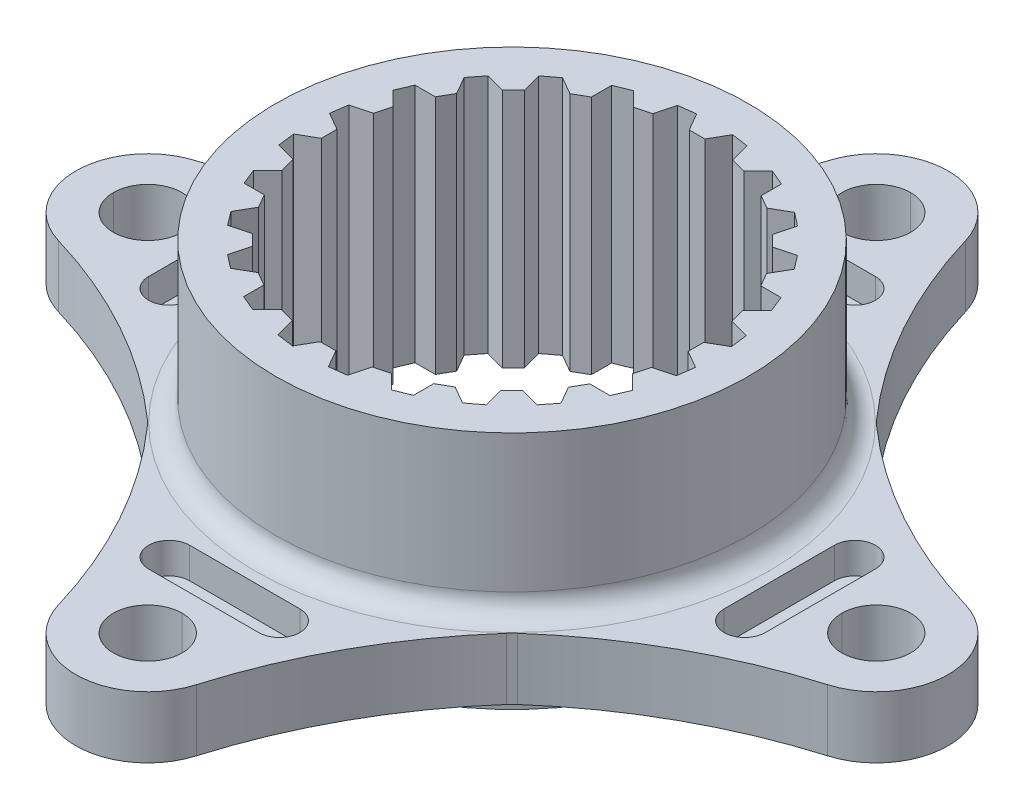
from build123d import *

# Parameters (mm, degrees)
SKETCH8_R                = 100
BOSS_EXTRUDE4_DEPTH      = 27.178
CUT_EXTRUDE1_DEPTH       = 145.009179166
SKETCH9_OUTSIDE_W        = 258.83
SKETCH9_OUTSIDE_H        = 258.83
SKETCH9_OUTSIDE_R        = 29.21
CUT_EXTRUDE3_DEPTH       = 19.558
CUT_EXTRUDE6_START       = -7.62
SKETCH11_R               = 100
CUT_EXTRUDE6_DEPTH       = 7.62
SKETCH10_R               = 4.2545
CUT_EXTRUDE7_DEPTH       = 7.62
FILLET2_R                = 2.54
FILLET3_R                = 7.62
CUT_EXTRUDE12_DEPTH      = 3.81
FILLET5_R                = 2.54
CIRPATTERN1_COUNT        = 4
FILLET5_OF_CIRPATTERN1_R = 2.54
SKETCH14_R               = 29.0322
BOSS_EXTRUDE5_DEPTH      = 2.54
CUT_EXTRUDE17_DEPTH      = 2.54


with BuildPart() as part:
    # Sketch8 → Boss-Extrude4 (new body)
    with BuildSketch(Plane(origin=(0, 0, 0), x_dir=(1, 0, 0), z_dir=(0, 1, 0))):
        with Locations(Location((0, 0, 0), (0, 0, 270))):
            Circle(SKETCH8_R)
    extrude(amount=BOSS_EXTRUDE4_DEPTH)

    # Sketch6 → Cut-Extrude1 (cut, through all)
    with BuildSketch(Plane(origin=(0, 0, 0), x_dir=(1, 0, 0), z_dir=(0, 1, 0))):
        Polygon((-0.9689411, -22.736267788), (0.9689411, -22.736267788), (2.2189411, -24.901331298), (4.303288018, -24.645405677), (4.950335631, -22.230591111), (6.822186096, -21.72903029), (8.589953049, -23.496797243), (10.537039143, -22.710123397), (10.537039143, -20.210123397), (12.215294358, -19.241182297), (14.380357867, -20.491182297), (16.057492438, -19.227370749), (15.410444825, -16.812556183), (16.78073447, -15.442266539), (19.195549035, -16.089314151), (20.488438134, -14.434491569), (19.238438134, -12.269428059), (20.207379233, -10.591172845), (22.707379233, -10.591172845), (23.527914603, -8.658112653), (21.76014765, -6.8903457), (22.261708471, -5.018495235), (24.676523036, -4.371447622), (24.968786548, -2.291884678), (22.803723039, -1.041884678), (22.803723039, 0.895997521), (24.968786548, 2.145997521), (24.712860927, 4.23034444), (22.298046362, 4.877392053), (21.796485541, 6.749242517), (23.564252494, 8.51700947), (22.777578648, 10.464095565), (20.277578648, 10.464095565), (19.308637548, 12.142350779), (20.558637548, 14.307414289), (19.294826, 15.98454886), (16.880011434, 15.337501247), (15.509721789, 16.707790891), (16.156769402, 19.122605457), (14.50194682, 20.415494555), (12.33688331, 19.165494555), (10.658628096, 20.134435655), (10.658628096, 22.634435655), (8.725567904, 23.454971025), (6.957800951, 21.687204072), (5.085950486, 22.188764892), (4.438902873, 24.603579458), (2.359339929, 24.89584297), (1.109339929, 22.730779461), (-0.828542271, 22.730779461), (-2.078542271, 24.89584297), (-4.162889189, 24.639917349), (-4.809936802, 22.225102783), (-6.681787267, 21.723541963), (-8.44955422, 23.491308916), (-10.396640314, 22.70463507), (-10.396640314, 20.20463507), (-12.074895529, 19.23569397), (-14.239959038, 20.48569397), (-15.917093609, 19.221882421), (-15.270045996, 16.807067856), (-16.640335641, 15.436778211), (-19.055150206, 16.083825824), (-20.348039305, 14.429003241), (-19.098039305, 12.263939732), (-20.066980404, 10.585684518), (-22.566980404, 10.585684518), (-23.387515774, 8.652624325), (-21.619748821, 6.884857372), (-22.121309642, 5.013006908), (-24.536124207, 4.365959295), (-24.828387719, 2.28639635), (-22.66332421, 1.03639635), (-22.66332421, -0.901485849), (-24.828387719, -2.151485849), (-24.572462098, -4.235832767), (-22.157647532, -4.88288038), (-21.656086712, -6.754730845), (-23.423853665, -8.522497798), (-22.637179819, -10.469583893), (-20.137179819, -10.469583893), (-19.168238719, -12.147839107), (-20.418238719, -14.312902616), (-19.154427171, -15.990037187), (-16.739612605, -15.342989575), (-15.36932296, -16.713279219), (-16.016370573, -19.128093785), (-14.361547991, -20.420982883), (-12.196484481, -19.170982883), (-10.518229267, -20.139923983), (-10.518229267, -22.639923983), (-8.585169075, -23.460459352), (-6.817402122, -21.6926924), (-4.945551657, -22.19425322), (-4.298504044, -24.609067786), (-2.2189411, -24.901331298), align=None)
    extrude(amount=CUT_EXTRUDE1_DEPTH, mode=Mode.SUBTRACT)

    # Sketch9 outside → Cut-Extrude3 (cut)
    with BuildSketch(Plane(origin=(0, 27.178, 0), x_dir=(1, 0, 0), z_dir=(0, 1, 0))):
        Rectangle(SKETCH9_OUTSIDE_W, SKETCH9_OUTSIDE_H)
        with Locations(Location((0, 0, 0), (0, 0, 270))):
            Circle(SKETCH9_OUTSIDE_R, mode=Mode.SUBTRACT)
    extrude(amount=-CUT_EXTRUDE3_DEPTH, mode=Mode.SUBTRACT)

    # Sketch11 → Cut-Extrude6 (cut)
    with BuildSketch(Plane(origin=(0, 7.62, 0), x_dir=(1, 0, 0), z_dir=(0, 1, 0)).offset(CUT_EXTRUDE6_START)):
        Circle(SKETCH11_R)
        with BuildLine():
            ThreePointArc((-8.523907443, 47.533696414), (0, 53.8988), (8.523907443, 47.533696414))
            ThreePointArc((8.523907443, 47.533696414), (14.122993805, 34.241994768), (22.5044, 22.5044))
            ThreePointArc((22.5044, 22.5044), (34.241994768, 14.122993805), (47.533696414, 8.523907443))
            ThreePointArc((47.533696414, 8.523907443), (52.131946395, 5.319105699), (53.8988, 0))
            ThreePointArc((53.8988, 0), (52.131946395, -5.319105699), (47.533696414, -8.523907443))
            ThreePointArc((47.533696414, -8.523907443), (34.241994768, -14.122993805), (22.5044, -22.5044))
            ThreePointArc((22.5044, -22.5044), (14.122993805, -34.241994768), (8.523907443, -47.533696414))
            ThreePointArc((8.523907443, -47.533696414), (0, -53.8988), (-8.523907443, -47.533696414))
            ThreePointArc((-8.523907443, -47.533696414), (-14.122993805, -34.241994768), (-22.5044, -22.5044))
            ThreePointArc((-22.5044, -22.5044), (-34.241994768, -14.122993805), (-47.533696414, -8.523907443))
            ThreePointArc((-47.533696414, -8.523907443), (-53.8988, 0), (-47.533696414, 8.523907443))
            ThreePointArc((-47.533696414, 8.523907443), (-34.241994768, 14.122993805), (-22.5044, 22.5044))
            ThreePointArc((-22.5044, 22.5044), (-14.122993805, 34.241994768), (-8.523907443, 47.533696414))
        make_face(mode=Mode.SUBTRACT)
    extrude(amount=CUT_EXTRUDE6_DEPTH, mode=Mode.SUBTRACT)

    # Sketch10 → Cut-Extrude7 (cut)
    with BuildSketch(Plane(origin=(0, 7.62, 0), x_dir=(1, 0, 0), z_dir=(0, 1, 0))):
        with Locations(Location((0, 45.0088, 0), (0, 0, 270))):
            Circle(SKETCH10_R)
        with Locations(Location((45.0088, 0, 0), (0, 0, 270))):
            Circle(SKETCH10_R)
        with Locations(Location((0, -45.0088, 0), (0, 0, 270))):
            Circle(SKETCH10_R)
        with Locations(Location((-45.0088, 0, 0), (0, 0, 270))):
            Circle(SKETCH10_R)
    extrude(amount=-CUT_EXTRUDE7_DEPTH, mode=Mode.SUBTRACT)

    # Fillet2
    fillet2_edges = [part.edges().sort_by_distance(p)[0] for p in [
        (0, 7.62, -29.21),
    ]]
    fillet(fillet2_edges, radius=FILLET2_R)

    # Fillet3
    fillet3_edges = [part.edges().sort_by_distance(p)[0] for p in [
        (-22.5044, 3.81, -22.5044),
        (-22.5044, 3.81, 22.5044),
        (22.5044, 3.81, 22.5044),
        (22.5044, 3.81, -22.5044),
    ]]
    fillet(fillet3_edges, radius=FILLET3_R)

    # Sketch13 → Cut-Extrude12 (cut)
    with BuildSketch(Plane(origin=(0, 7.62, 0), x_dir=(1, 0, 0), z_dir=(0, 1, 0))):
        Polygon((-8.426157097, 38.1), (8.426157097, 38.1), (10.795, 33.02), (-10.795, 33.02), align=None)
    cut_extrude12 = extrude(amount=-CUT_EXTRUDE12_DEPTH, mode=Mode.SUBTRACT)

    # Fillet5
    fillet5_edges = [part.edges().sort_by_distance(p)[0] for p in [
        (-10.795, 5.715, -33.02),
        (10.795, 5.715, -33.02),
        (-8.426157097, 5.715, -38.1),
        (8.426157097, 5.715, -38.1),
    ]]
    fillet(fillet5_edges, radius=FILLET5_R - 0.0001)  # a hair under: the kernel refuses the full size

    # CirPattern1: Cut-Extrude12 ×4 about axis
    cirpattern1_axis = Axis((0, 0, 0), (0, 1, 0))
    for i in range(1, CIRPATTERN1_COUNT):
        add(cut_extrude12.rotate(cirpattern1_axis, i * 360 / CIRPATTERN1_COUNT), mode=Mode.SUBTRACT)

    # Fillet5 of CirPattern1
    fillet5_of_cirpattern1_edges = [part.edges().sort_by_distance(p)[0] for p in [
        (-33.02, 5.715, 10.795),
        (-33.02, 5.715, -10.795),
        (-38.1, 5.715, 8.426157097),
        (-38.1, 5.715, -8.426157097),
        (10.795, 5.715, 33.02),
        (-10.795, 5.715, 33.02),
        (8.426157097, 5.715, 38.1),
        (-8.426157097, 5.715, 38.1),
        (33.02, 5.715, -10.795),
        (33.02, 5.715, 10.795),
        (38.1, 5.715, -8.426157097),
        (38.1, 5.715, 8.426157097),
    ]]
    fillet(fillet5_of_cirpattern1_edges, radius=FILLET5_OF_CIRPATTERN1_R - 0.0001)  # a hair under: the kernel refuses the full size

    # Sketch14 → Boss-Extrude5 (add)
    with BuildSketch(Plane.XZ):
        with Locations(Location((0, 0, 0), (0, 0, 90))):
            Circle(SKETCH14_R)
    extrude(amount=BOSS_EXTRUDE5_DEPTH)

    # Sketch6<5> → Cut-Extrude17 (cut)
    with BuildSketch(Plane(origin=(0, 0, 0), x_dir=(1, 0, 0), z_dir=(0, 1, 0))):
        Polygon((-0.9689411, -22.736267788), (0.9689411, -22.736267788), (2.2189411, -24.901331298), (4.303288018, -24.645405677), (4.950335631, -22.230591111), (6.822186096, -21.72903029), (8.589953049, -23.496797243), (10.537039143, -22.710123397), (10.537039143, -20.210123397), (12.215294358, -19.241182297), (14.380357867, -20.491182297), (16.057492438, -19.227370749), (15.410444825, -16.812556183), (16.78073447, -15.442266539), (19.195549035, -16.089314151), (20.488438134, -14.434491569), (19.238438134, -12.269428059), (20.207379233, -10.591172845), (22.707379233, -10.591172845), (23.527914603, -8.658112653), (21.76014765, -6.8903457), (22.261708471, -5.018495235), (24.676523036, -4.371447622), (24.968786548, -2.291884678), (22.803723039, -1.041884678), (22.803723039, 0.895997521), (24.968786548, 2.145997521), (24.712860927, 4.23034444), (22.298046362, 4.877392053), (21.796485541, 6.749242517), (23.564252494, 8.51700947), (22.777578648, 10.464095565), (20.277578648, 10.464095565), (19.308637548, 12.142350779), (20.558637548, 14.307414289), (19.294826, 15.98454886), (16.880011434, 15.337501247), (15.509721789, 16.707790891), (16.156769402, 19.122605457), (14.50194682, 20.415494555), (12.33688331, 19.165494555), (10.658628096, 20.134435655), (10.658628096, 22.634435655), (8.725567904, 23.454971025), (6.957800951, 21.687204072), (5.085950486, 22.188764892), (4.438902873, 24.603579458), (2.359339929, 24.89584297), (1.109339929, 22.730779461), (-0.828542271, 22.730779461), (-2.078542271, 24.89584297), (-4.162889189, 24.639917349), (-4.809936802, 22.225102783), (-6.681787267, 21.723541963), (-8.44955422, 23.491308916), (-10.396640314, 22.70463507), (-10.396640314, 20.20463507), (-12.074895529, 19.23569397), (-14.239959038, 20.48569397), (-15.917093609, 19.221882421), (-15.270045996, 16.807067856), (-16.640335641, 15.436778211), (-19.055150206, 16.083825824), (-20.348039305, 14.429003241), (-19.098039305, 12.263939732), (-20.066980404, 10.585684518), (-22.566980404, 10.585684518), (-23.387515774, 8.652624325), (-21.619748821, 6.884857372), (-22.121309642, 5.013006908), (-24.536124207, 4.365959295), (-24.828387719, 2.28639635), (-22.66332421, 1.03639635), (-22.66332421, -0.901485849), (-24.828387719, -2.151485849), (-24.572462098, -4.235832767), (-22.157647532, -4.88288038), (-21.656086712, -6.754730845), (-23.423853665, -8.522497798), (-22.637179819, -10.469583893), (-20.137179819, -10.469583893), (-19.168238719, -12.147839107), (-20.418238719, -14.312902616), (-19.154427171, -15.990037187), (-16.739612605, -15.342989575), (-15.36932296, -16.713279219), (-16.016370573, -19.128093785), (-14.361547991, -20.420982883), (-12.196484481, -19.170982883), (-10.518229267, -20.139923983), (-10.518229267, -22.639923983), (-8.585169075, -23.460459352), (-6.817402122, -21.6926924), (-4.945551657, -22.19425322), (-4.298504044, -24.609067786), (-2.2189411, -24.901331298), align=None)
    extrude(amount=-CUT_EXTRUDE17_DEPTH, mode=Mode.SUBTRACT)


solid = part.part
